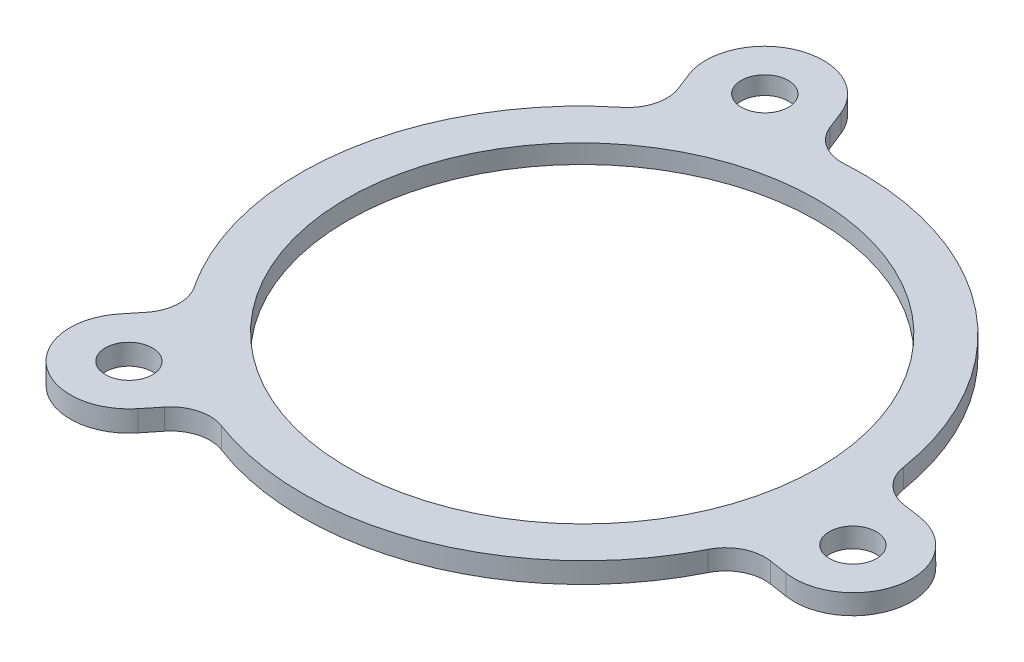
from build123d import *

# Parameters (mm, degrees)
BOSS_EXTRUDE1_REACH = 49.936
SKETCH2_R           = 12
SKETCH2_R_2         = 1.2


with BuildPart() as part:
    # Boss-Extrude1: up to this plane
    boss_extrude1_end = Plane(origin=(0, 0.999974382, -0.005061368), z_dir=(0, 0.9999871908648438, -0.005061433219798703))
    # Sketch2 → Boss-Extrude1 (new, up to the surface)
    with BuildSketch(Plane(origin=(0, 0, 0), x_dir=(1, 0, 0), z_dir=(0, 1, 0)), mode=Mode.PRIVATE) as boss_extrude1_sk1:
        with BuildLine():
            Line((-8.813634389, 14.267790609), (-8.460765596, 13.367375576))
            ThreePointArc((-8.460765596, 13.367375576), (-8.388150437, 12.130835815), (-9.05764982, 11.088687016))
            ThreePointArc((-9.05764982, 11.088687016), (-14.156836939, 2.14102029), (-11.931590899, -7.914362805))
            ThreePointArc((-11.931590899, -7.914362805), (-11.600204415, -9.107881359), (-12.035226867, -10.267648149))
            Line((-12.035226867, -10.267648149), (-12.638574763, -11.023449005))
            ThreePointArc((-12.638574763, -11.023449005), (-12.165652136, -15.239649212), (-7.949451928, -14.766726585))
            Line((-7.949451928, -14.766726585), (-7.346104032, -14.01092573))
            ThreePointArc((-7.346104032, -14.01092573), (-6.311536766, -13.329769277), (-5.074259741, -13.38849835))
            ThreePointArc((-5.074259741, -13.38849835), (5.224240508, -13.330690571), (12.819834694, -6.375879424))
            ThreePointArc((12.819834694, -6.375879424), (13.687758839, -5.492131033), (14.909657568, -5.288988132))
            Line((14.909657568, -5.288988132), (15.865874257, -5.43360231))
            ThreePointArc((15.865874257, -5.43360231), (19.28074943, -2.915939197), (16.763086318, 0.498935976))
            Line((16.763086318, 0.498935976), (15.806869628, 0.643550154))
            ThreePointArc((15.806869628, 0.643550154), (14.699687203, 1.198933462), (14.131909561, 2.299811334))
            ThreePointArc((14.131909561, 2.299811334), (8.932596431, 11.189670281), (-0.888243794, 14.290242229))
            ThreePointArc((-0.888243794, 14.290242229), (-2.087554424, 14.600012392), (-2.874430701, 15.556636282))
            Line((-2.874430701, 15.556636282), (-3.227299494, 16.457051315))
            ThreePointArc((-3.227299494, 16.457051315), (-7.115097295, 18.155588409), (-8.813634389, 14.267790609))
        make_face()
        Circle(SKETCH2_R, mode=Mode.SUBTRACT)
        with Locations((-6.020466942, 15.362420962)):
            Circle(SKETCH2_R_2, mode=Mode.SUBTRACT)
        with Locations((16.314480287, -2.467333167)):
            Circle(SKETCH2_R_2, mode=Mode.SUBTRACT)
        with Locations((-10.294013346, -12.895087795)):
            Circle(SKETCH2_R_2, mode=Mode.SUBTRACT)
    boss_extrude1_tool1 = split(extrude(boss_extrude1_sk1.sketch, amount=BOSS_EXTRUDE1_REACH, mode=Mode.PRIVATE), bisect_by=boss_extrude1_end, keep=Keep.BOTH, mode=Mode.PRIVATE)
    add(boss_extrude1_tool1.solids().sort_by_distance((-2.345651, 0, -14.19522))[0])


solid = part.part
